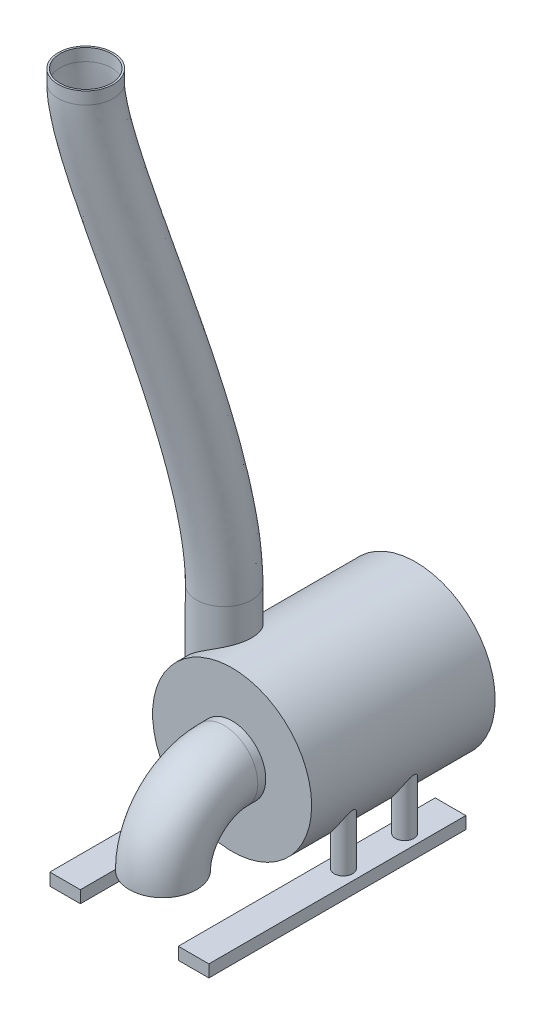
from build123d import *

# Parameters (mm, degrees)
SKETCH1_R                = 130
BOSS_EXTRUDE1_DEPTH      = 300
SKETCH2_R                = 55
BOSS_EXTRUDE2_DEPTH      = 13
SKETCH3_R                = 117
SKETCH3_R_2              = 72
CUT_EXTRUDE2_DEPTH       = 13
CUT_EXTRUDE2_DRAFT       = -30
SKETCH4_R                = 22.5
BOSS_EXTRUDE3_DEPTH      = 7
BOSS_EXTRUDE3_TAPER      = 30
BOSS_EXTRUDE4_REACH      = 525
BOSS_EXTRUDE4_END_RADIUS = 130
BOSS_EXTRUDE4_START      = 160
SKETCH5_R                = 45
SWEEP2_OUTLINE_R         = 55
SWEEP2_ANGLE             = 90
BOSS_EXTRUDE5_START      = -140
SKETCH11_W               = 50
SKETCH11_H               = 420
BOSS_EXTRUDE5_DEPTH      = 20
BOSS_EXTRUDE6_REACH      = 572.898
BOSS_EXTRUDE6_END_RADIUS = 130
SKETCH12_R               = 15
SHELL2_T                 = -3
SKETCH14_R               = 45
SKETCH14_R_2             = 42


with BuildPart() as part:
    # Sketch1 → Boss-Extrude1 (new body)
    with BuildSketch(Plane.XY):
        Circle(SKETCH1_R)
    extrude(amount=BOSS_EXTRUDE1_DEPTH)

    # Sketch2 → Boss-Extrude2 (add)
    with BuildSketch(Plane.XY.offset(300)):
        with Locations(Location((0, 0, 0), (0, 0, 180))):
            Circle(SKETCH2_R)
    extrude(amount=BOSS_EXTRUDE2_DEPTH)


with BuildPart() as cut_extrude2_tool:
    # Sketch3 → Cut-Extrude2 (with draft: the straight prism first)
    with BuildSketch(Plane(origin=(0, 0, 0), x_dir=(-1, 0, 0), z_dir=(0, 0, -1))):
        Circle(SKETCH3_R)
        Circle(SKETCH3_R_2, mode=Mode.SUBTRACT)
    extrude(amount=-CUT_EXTRUDE2_DEPTH)
    # Cut-Extrude2: the draft: its side faces are tilted about the plane it starts from
    cut_extrude2_sides = [cut_extrude2_tool.faces().sort_by_distance(p)[0] for p in [
        (117, 0, 6.5),
        (72, 0, 6.5),
    ]]
    draft(cut_extrude2_sides, Plane(origin=(0, 0, 0), x_dir=(-1, 0, 0), z_dir=(0, 0, -1)), CUT_EXTRUDE2_DRAFT)


with BuildPart() as part_1:
    add(part.part)

    # Cut-Extrude2: cut by cut_extrude2_tool
    add(cut_extrude2_tool.part, mode=Mode.SUBTRACT)

    # Sketch4 → Boss-Extrude3 (add)
    with BuildSketch(Plane(origin=(0, 0, 0), x_dir=(-1, 0, 0), z_dir=(0, 0, -1))):
        Circle(SKETCH4_R)
    extrude(amount=BOSS_EXTRUDE3_DEPTH, taper=BOSS_EXTRUDE3_TAPER)

    # Boss-Extrude4: up to this cylinder (the profile starts outside it)
    boss_extrude4_end = Plane(origin=(0, 0, 238), z_dir=(0, 0, -1)) * Cylinder(BOSS_EXTRUDE4_END_RADIUS, 1311, mode=Mode.PRIVATE)
    # Sketch5 → Boss-Extrude4 (add, up to the surface)
    with BuildSketch(Plane(origin=(0, 0, 0), x_dir=(1, 0, 0), z_dir=(0, 1, 0)).offset(BOSS_EXTRUDE4_START), mode=Mode.PRIVATE) as boss_extrude4_sk1:
        with Locations(Location((-75, -238, 0), (0, 0, 270))):
            Circle(SKETCH5_R)
    boss_extrude4_tool1 = extrude(boss_extrude4_sk1.sketch, amount=-BOSS_EXTRUDE4_REACH, mode=Mode.PRIVATE) - boss_extrude4_end
    add(boss_extrude4_tool1.solids().sort_by_distance((-75, 160, 238))[0])

    # Sweep2: read off the stored shape, not the designer's step
    # Sweep2 outline → Sweep2 (revolve)
    with BuildSketch(Plane(origin=(0, -100, 313), x_dir=(0, 1, 0), z_dir=(0, 0, -1))):
        with Locations((100, 0)):
            Circle(SWEEP2_OUTLINE_R)
    revolve(axis=Axis((0, -100, 313), (1, 0, 0)), revolution_arc=SWEEP2_ANGLE)



with BuildPart() as body_2:
    # Sketch11 → Boss-Extrude5 (new body)
    with BuildSketch(Plane(origin=(0, 0, 0), x_dir=(1, 0, 0), z_dir=(0, 1, 0)).offset(BOSS_EXTRUDE5_START)):
        with Locations((-105, -258)):
            Rectangle(SKETCH11_W, SKETCH11_H)
    boss_extrude5 = extrude(amount=-BOSS_EXTRUDE5_DEPTH)


with BuildPart() as part_2:
    add(part_1.part)

    add(body_2.part)  # Boss-Extrude6 merges body 2
    # Boss-Extrude6: up to this cylinder (the profile starts outside it)
    boss_extrude6_end = Plane(origin=(0, 0, 173), z_dir=(0, 0, -1)) * Cylinder(BOSS_EXTRUDE6_END_RADIUS, 1506.796, mode=Mode.PRIVATE)
    # Sketch12 → Boss-Extrude6 (add, up to the surface)
    with BuildSketch(Plane(origin=(0, -140, 0), x_dir=(1, 0, 0), z_dir=(0, 1, 0)), mode=Mode.PRIVATE) as boss_extrude6_sk1:
        with Locations(Location((-105, -123, 0), (0, 0, 90))):
            Circle(SKETCH12_R)
    boss_extrude6_tool1 = extrude(boss_extrude6_sk1.sketch, amount=BOSS_EXTRUDE6_REACH, mode=Mode.PRIVATE) - boss_extrude6_end
    # Sketch12 → Boss-Extrude6 (add, up to the surface)
    with BuildSketch(Plane(origin=(0, -140, 0), x_dir=(1, 0, 0), z_dir=(0, 1, 0)), mode=Mode.PRIVATE) as boss_extrude6_sk2:
        with Locations(Location((-105, -223, 0), (0, 0, 90))):
            Circle(SKETCH12_R)
    boss_extrude6_tool2 = extrude(boss_extrude6_sk2.sketch, amount=BOSS_EXTRUDE6_REACH, mode=Mode.PRIVATE) - boss_extrude6_end
    boss_extrude6 = boss_extrude6_tool1.solids().sort_by_distance((-105, -140, 123))[0] + boss_extrude6_tool2.solids().sort_by_distance((-105, -140, 223))[0]
    add(boss_extrude6)

    # Mirror2: Boss-Extrude5, Boss-Extrude6 across plane
    add(boss_extrude5.mirror(Plane(origin=(0, 0, 0), x_dir=(0, 0, 1), z_dir=(1, 0, 0))))
    add(boss_extrude6.mirror(Plane(origin=(0, 0, 0), x_dir=(0, 0, 1), z_dir=(1, 0, 0))))

    # Shell2
    shell2_openings = [part_2.faces().sort_by_distance(p)[0] for p in [
        (-75, 160, 238),
        (0, -100, 413),
    ]]
    offset(amount=SHELL2_T, openings=shell2_openings, kind=Kind.INTERSECTION)

    # Sweep3: sweep along a path in Sketch15
    with BuildLine() as sweep3_path:  # in the path sketch's own coordinates; laid on its plane below (add() does not lay a ready-made edge on the line's plane)
        Line((160, 221.324422511), (180, 221.324422511))
        add(Edge.make_bspline(
            [(180, 221.324422511), (396.666666667, 221.324422511), (773.333333333, 381.324422511), (890, 381.324422511)],
            knots=[0, 0, 0, 0, 1, 1, 1, 1], degree=3))
        Line((890, 381.324422511), (910, 381.324422511))
    # Sketch14 → Sweep3 (sweep)
    with BuildSketch(Plane(origin=(0, 160, 0), x_dir=(1, 0, 0), z_dir=(0, 1, 0))):
        with Locations((-75, -238)):
            Circle(SKETCH14_R)
        with Locations((-75, -238)):
            Circle(SKETCH14_R_2, mode=Mode.SUBTRACT)
    sweep(path=Plane(origin=(81.5, 0, 81.5), x_dir=(0, 1, 0), z_dir=(0.7071067811865464, 0, 0.7071067811865488)) * sweep3_path.line)


solid = part_2.part
